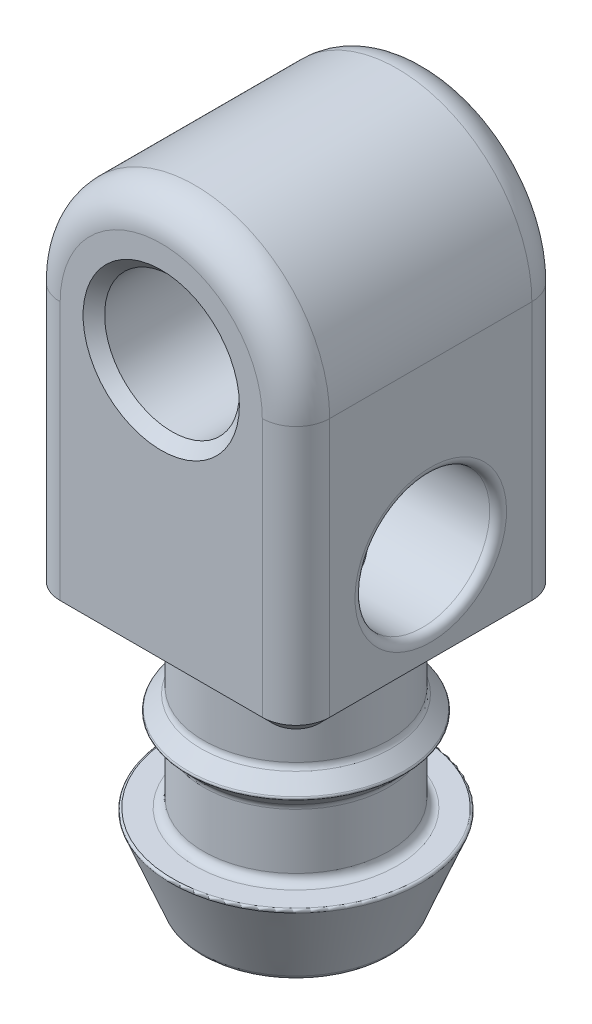
from build123d import *

# Parameters (mm, degrees)
SKETCH1_R                                  = 3.175
BOSS_EXTRUDE1_DEPTH                        = 6.35
SKETCH3_R                                  = 2.38125
CUT_EXTRUDE1_DEPTH                         = 20.955
CBORE_FOR_1_4_SOCKET_SHOULDER_SCREW1_OUT_R = 3.175
CBORE_FOR_1_4_SOCKET_SHOULDER_SCREW1_DEPTH = 6.35
FILLET1_R                                  = 1.5875
FILLET2_R                                  = 0.396875
FILLET3_R                                  = 0.09921875
CHAMFER1_SIZE                              = 0.508
CHAMFER2_SIZE                              = 0.254


# Read off the part's stored shape, not the designer's step: CBORE for 1/4 Socket Shoulder Screw1
with BuildPart() as part:
    # Sketch1 → Boss-Extrude1 (new, symmetric)
    with BuildSketch(Plane.XY):
        with BuildLine():
            Line((-6.35, 0), (-6.35, -12.7))
            Line((-6.35, -12.7), (6.35, -12.7))
            Line((6.35, -12.7), (6.35, 0))
            ThreePointArc((6.35, 0), (0, 6.35), (-6.35, 0))
        make_face()
        Circle(SKETCH1_R, mode=Mode.SUBTRACT)
    extrude(amount=BOSS_EXTRUDE1_DEPTH, both=True)

    # Sketch2 → Revolve1 (revolve)
    with BuildSketch(Plane.XY, mode=Mode.PRIVATE) as revolve1_sk:
        Polygon((0, -12.7), (4.365625, -12.7), (4.365625, -16.66875), (5.159375, -17.4625), (4.365625, -18.25625), (4.365625, -21.43125), (5.953125, -21.43125), (4.365625, -25.4), (0, -25.4), align=None)
    revolve(revolve1_sk.sketch.rotate(Axis((0, 9.54404991, 0), (0, -1, 0)), 180), axis=Axis((0, 9.54404991, 0), (0, -1, 0)))

    # Sketch3 → Cut-Extrude1 (cut)
    with BuildSketch(Plane.XZ.offset(25.4)):
        Circle(SKETCH3_R)
    extrude(amount=-CUT_EXTRUDE1_DEPTH, mode=Mode.SUBTRACT)

    # CBORE for 1/4 Socket Shoulder Screw1 out → CBORE for 1/4 Socket Shoulder Screw1 (cut)
    with BuildSketch(Plane.YZ):
        with Locations((-7.9375, 0)):
            Circle(CBORE_FOR_1_4_SOCKET_SHOULDER_SCREW1_OUT_R)
    extrude(amount=CBORE_FOR_1_4_SOCKET_SHOULDER_SCREW1_DEPTH, mode=Mode.SUBTRACT)

    # Fillet1
    fillet1_edges = [part.edges().sort_by_distance(p)[0] for p in [
        (-6.35, -6.35, 6.35),
        (6.35, -6.35, 6.35),
        (0, 6.35, -6.35),
        (-6.35, -6.35, -6.35),
        (6.35, -6.35, -6.35),
        (0, 6.35, 6.35),
    ]]
    fillet(fillet1_edges, radius=FILLET1_R)

    # Fillet2
    fillet2_edges = [part.edges().sort_by_distance(p)[0] for p in [
        (4.365625, -12.7, 0),
        (4.365625, -16.66875, 0),
        (4.365625, -18.25625, 0),
        (4.365625, -21.43125, 0),
        (4.365625, -25.4, 0),
        (6.35, -11.1125, 0),
    ]]
    fillet(fillet2_edges, radius=FILLET2_R)

    # Fillet3
    fillet3_edges = [part.edges().sort_by_distance(p)[0] for p in [
        (5.159375, -17.4625, 0),
        (5.953125, -21.43125, 0),
    ]]
    fillet(fillet3_edges, radius=FILLET3_R)

    # Chamfer1
    chamfer1_edges = [part.edges().sort_by_distance(p)[0] for p in [
        (-3.175, 0, -6.35),
        (-3.175, 0, 6.35),
        (6.35, -12.7, 0),
        (0, -12.7, -6.35),
        (0, -12.7, 6.35),
        (-6.35, -12.7, 0),
        (5.885032015, -12.7, 5.885032015),
        (-5.885032015, -12.7, 5.885032015),
        (-5.885032015, -12.7, -5.885032015),
        (5.885032015, -12.7, -5.885032015),
    ]]
    chamfer(chamfer1_edges, length=CHAMFER1_SIZE)

    # Chamfer2
    chamfer2_edges = [part.edges().sort_by_distance(p)[0] for p in [
        (-2.38125, -25.4, 0),
    ]]
    chamfer(chamfer2_edges, length=CHAMFER2_SIZE)


solid = part.part
